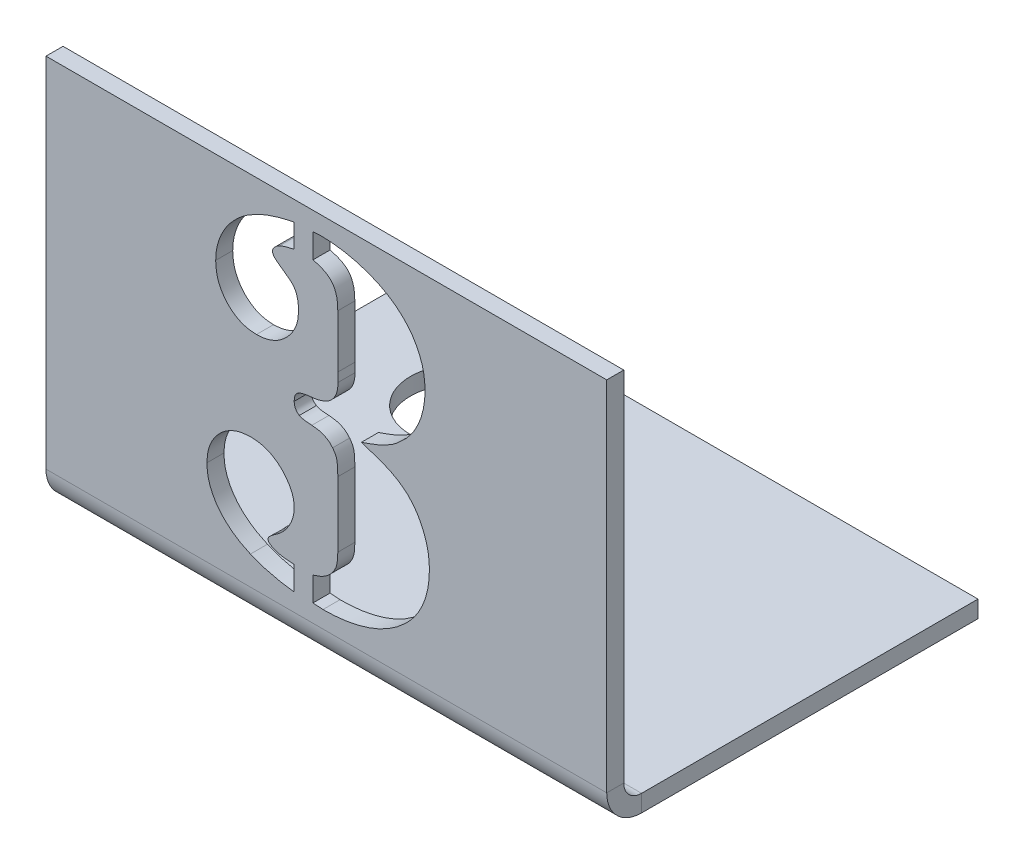
from build123d import *

# Parameters (mm, degrees)
SKETCH1_W            = 50
SKETCH1_H            = 30
BASE_FLANGE1_DEPTH   = 1.51892
EDGE_FLANGE1_DEPTH   = 50
M8_CLEARANCE_HOLE1_D = 9
CUT_EXTRUDE1_DEPTH   = 55.277389816


# Sheet-metal steps are written as plain solids
with BuildPart() as part:
    # Sketch1 → Base-Flange1 (new body)
    with BuildSketch(Plane(origin=(0, 0, 0), x_dir=(1, 0, 0), z_dir=(0, 1, 0))):
        with Locations((0, 15)):
            Rectangle(SKETCH1_W, SKETCH1_H)
    extrude(amount=BASE_FLANGE1_DEPTH)

    # Edge-Flange1 section (across the edge) → Edge-Flange1 (add)
    with BuildSketch(Plane(origin=(-25, 1.51892, 1.5875), x_dir=(0, 0, -1), z_dir=(1, 0, 0))):
        with BuildLine():
            Line((-1.51892, 1.5875), (-1.51892, 33.48108))
            Line((-1.51892, 33.48108), (0, 33.48108))
            Line((0, 33.48108), (0, 1.5875))
            ThreePointArc((0, 1.5875), (0.464967985, 0.464967985), (1.5875, 0))
            Line((1.5875, 0), (1.5875, -1.51892))
            ThreePointArc((1.5875, -1.51892), (-0.609070647, -0.609070647), (-1.51892, 1.5875))
        make_face()
    extrude(amount=EDGE_FLANGE1_DEPTH)

    # M8 Clearance Hole1 (through all)
    with Locations(Plane(origin=(0, 1.51892, 0), x_dir=(1, 0, 0), z_dir=(0, 1, 0))):
        with Locations((-13, 21.89358)):
            Hole(M8_CLEARANCE_HOLE1_D / 2)

    # Sketch11 → Cut-Extrude1 (cut, through all)
    with BuildSketch(Plane.XY.offset(3.10642)):
        with BuildLine():
            Line((-2.869538569, 33.243055556), (-2.869538569, 31.146701389))
            add(Edge.make_bspline(
                [(-2.869538569, 31.146701389), (-3.01357232, 31.115282068), (-3.280496425, 31.057055618), (-3.646840415, 30.962343881), (-3.9475465, 30.860313138), (-4.121760767, 30.781276405), (-4.200267736, 30.745659722)],
                knots=[0, 0, 0, 0, 1.269686499, 2.352989703, 3.257800252, 4, 4, 4, 4], degree=3))
            add(Edge.make_bspline(
                [(-4.200267736, 30.745659722), (-4.281834981, 30.700375981), (-4.44405021, 30.610318847), (-4.631868386, 30.42554641), (-4.778100714, 30.243615535), (-4.803405221, 30.109157533), (-4.813983013, 30.052951389)],
                knots=[0, 0, 0, 0, 1.160818746, 2.308555075, 3.292942072, 4, 4, 4, 4], degree=3))
            add(Edge.make_bspline(
                [(-4.813983013, 30.052951389), (-4.802283278, 29.997478267), (-4.777259629, 29.878831144), (-4.681807175, 29.704434105), (-4.520753141, 29.540755171), (-4.391964004, 29.43963963), (-4.321795513, 29.384548611)],
                knots=[0, 0, 0, 0, 0.7940992, 1.698436706, 2.746033816, 4, 4, 4, 4], degree=3))
            Line((-4.321795513, 29.384548611), (-3.252351069, 28.606770833))
            add(Edge.make_bspline(
                [(-3.252351069, 28.606770833), (-3.130862875, 28.499857988), (-2.882411926, 28.281214539), (-2.649527269, 27.806319007), (-2.50193834, 27.242757243), (-2.488090423, 26.829623379), (-2.48064968, 26.607638889)],
                knots=[0, 0, 0, 0, 0.867032692, 1.773136037, 2.803464674, 4, 4, 4, 4], degree=3))
            add(Edge.make_bspline(
                [(-2.48064968, 26.607638889), (-2.492637492, 26.361098821), (-2.516268305, 25.875110038), (-2.730466948, 25.175617912), (-3.088519053, 24.537190693), (-3.564773974, 23.967252331), (-4.134379829, 23.487656489), (-4.781738186, 23.14019304), (-5.486902729, 22.923424184), (-5.979090846, 22.900543117), (-6.229781625, 22.888888889)],
                knots=[0, 0, 0, 0, 1.007343294, 1.985711883, 2.961723928, 3.986119113, 5.010514297, 5.989830935, 6.976141781, 8, 8, 8, 8], degree=3))
            add(Edge.make_bspline(
                [(-6.229781625, 22.888888889), (-6.478327854, 22.903156783), (-6.964184536, 22.931047576), (-7.663353586, 23.144006328), (-8.292040001, 23.50556869), (-8.845310092, 23.993701438), (-9.298490935, 24.586871582), (-9.633360061, 25.260423943), (-9.832658042, 26.004994474), (-9.857014264, 26.52337312), (-9.869538569, 26.789930556)],
                knots=[0, 0, 0, 0, 1.001909129, 1.958525973, 2.917513965, 3.907788383, 4.91637554, 5.910554521, 6.925578375, 8, 8, 8, 8], degree=3))
            add(Edge.make_bspline(
                [(-9.869538569, 26.789930556), (-9.859889219, 27.025587755), (-9.840670068, 27.494959385), (-9.694589077, 28.187617489), (-9.462380398, 28.861547201), (-9.137798547, 29.51157095), (-8.732886437, 30.132437614), (-8.239142713, 30.701494978), (-7.688708992, 31.240857761), (-7.265229198, 31.541065603), (-7.050094125, 31.693576389)],
                knots=[0, 0, 0, 0, 0.960214927, 1.912513803, 2.873580615, 3.859654398, 4.867447084, 5.886778922, 6.926447075, 8, 8, 8, 8], degree=3))
            add(Edge.make_bspline(
                [(-7.050094125, 31.693576389), (-6.772080974, 31.862281532), (-6.189737815, 32.215661528), (-5.20167575, 32.633053003), (-4.084196932, 32.986281736), (-3.286550907, 33.15490085), (-2.869538569, 33.243055556)],
                knots=[0, 0, 0, 0, 0.86898849, 1.820235845, 2.860411111, 4, 4, 4, 4], degree=3))
        make_face()
        with BuildLine():
            add(Edge.make_bspline(
                [(3.127857264, 19.243055556), (3.399533056, 19.156779447), (3.9099092, 18.994699245), (4.619293445, 18.756064829), (5.218126213, 18.526205667), (5.860268683, 18.238928986), (6.55822811, 17.851769501), (7.028568149, 17.45241251), (7.259801709, 17.256076389)],
                knots=[0, 0, 0, 0, 1.109244647, 2.083851495, 2.912330965, 3.60379954, 4.821954509, 6, 6, 6, 6], degree=3))
            add(Edge.make_bspline(
                [(7.259801709, 17.256076389), (7.403085424, 17.109301178), (7.691101186, 16.814267132), (8.066056013, 16.30561361), (8.389598844, 15.740320931), (8.675141336, 15.129505705), (8.904554905, 14.48483349), (9.069496151, 13.817416154), (9.169628617, 13.137330205), (9.180554624, 12.678860674), (9.186016987, 12.449652778)],
                knots=[0, 0, 0, 0, 0.925681824, 1.860720568, 2.844614321, 3.863818686, 4.902667566, 5.930051873, 6.965147251, 8, 8, 8, 8], degree=3))
            add(Edge.make_bspline(
                [(9.186016987, 12.449652778), (9.181658716, 12.189958532), (9.173109529, 11.680542176), (9.062347215, 10.937072307), (8.904596862, 10.226030331), (8.660773743, 9.555195425), (8.365180383, 8.910174803), (7.992199613, 8.305678266), (7.558241504, 7.729843198), (7.219380124, 7.386391142), (7.047128098, 7.211805556)],
                knots=[0, 0, 0, 0, 1.069636491, 2.098199453, 3.092710985, 4.06725094, 5.034789928, 6.012900685, 6.989905889, 8, 8, 8, 8], degree=3))
            add(Edge.make_bspline(
                [(7.047128098, 7.211805556), (6.82076841, 7.007619098), (6.36470834, 6.596232726), (5.590429044, 6.078292356), (4.753201656, 5.621324343), (3.841494966, 5.257205024), (2.874230844, 4.963704604), (1.854844744, 4.758844409), (0.789438496, 4.636181022), (0.063659631, 4.619560458), (-0.305302458, 4.611111111)],
                knots=[0, 0, 0, 0, 0.914358564, 1.842211554, 2.789262651, 3.774150871, 4.784330977, 5.820899479, 6.892217011, 8, 8, 8, 8], degree=3))
            Line((-0.305302458, 4.611111111), (-1.192455236, 4.677951389))
            Line((-1.192455236, 4.677951389), (-1.192455236, 6.828993056))
            add(Edge.make_bspline(
                [(-1.192455236, 6.828993056), (-1.012335342, 6.884888557), (-0.670196011, 6.991062556), (-0.212405477, 7.217072889), (0.17137983, 7.478137224), (0.370520183, 7.692115991), (0.466398931, 7.795138889)],
                knots=[0, 0, 0, 0, 1.160234497, 2.203875682, 3.135232274, 4, 4, 4, 4], degree=3))
            add(Edge.make_bspline(
                [(0.466398931, 7.795138889), (0.559176182, 7.919267749), (0.740278408, 8.161568667), (0.920686343, 8.599633432), (1.006344359, 9.118338926), (1.014703405, 9.494186105), (1.01935032, 9.703125)],
                knots=[0, 0, 0, 0, 0.912418212, 1.781050509, 2.766453814, 4, 4, 4, 4], degree=3))
            Line((1.01935032, 9.703125), (1.01935032, 15.530381944))
            add(Edge.make_bspline(
                [(1.01935032, 15.530381944), (1.017394838, 15.664035552), (1.013779291, 15.911151497), (1.007803164, 16.252339027), (0.973985032, 16.533739407), (0.930986746, 16.835410712), (0.813838875, 17.180859331), (0.645473079, 17.409898938), (0.557544764, 17.529513889)],
                knots=[0, 0, 0, 0, 1.14638434, 2.119582521, 2.923191533, 3.574181997, 4.73312696, 6, 6, 6, 6], degree=3))
            add(Edge.make_bspline(
                [(0.557544764, 17.529513889), (0.451698553, 17.647488045), (0.235458824, 17.8885047), (-0.206751022, 18.134080192), (-0.724105338, 18.295106819), (-1.09794382, 18.326917788), (-1.295753847, 18.34375)],
                knots=[0, 0, 0, 0, 0.905434972, 1.849768747, 2.86224313, 4, 4, 4, 4], degree=3))
            add(Edge.make_bspline(
                [(-1.295753847, 18.34375), (-1.423505644, 18.352575986), (-1.657320976, 18.368729582), (-1.972470407, 18.408380295), (-2.219734611, 18.462774475), (-2.351672252, 18.524233198), (-2.407733013, 18.550347222)],
                knots=[0, 0, 0, 0, 1.349224309, 2.469392492, 3.349639561, 4, 4, 4, 4], degree=3))
            add(Edge.make_bspline(
                [(-2.407733013, 18.550347222), (-2.477979947, 18.59934055), (-2.616454801, 18.695919057), (-2.763510355, 18.903405953), (-2.853240567, 19.144951477), (-2.863946526, 19.317165512), (-2.869538569, 19.407118056)],
                knots=[0, 0, 0, 0, 1.002692209, 1.976565387, 2.943099551, 4, 4, 4, 4], degree=3))
            add(Edge.make_bspline(
                [(-2.869538569, 19.407118056), (-2.866820405, 19.494522373), (-2.861685312, 19.659644567), (-2.803631102, 19.888249453), (-2.696849273, 20.072170003), (-2.545198602, 20.218941416), (-2.329831682, 20.319939632), (-2.055295045, 20.401344932), (-1.709142225, 20.467776459), (-1.454030953, 20.493062962), (-1.313983013, 20.506944444)],
                knots=[0, 0, 0, 0, 0.964154815, 1.821458751, 2.573364043, 3.28527986, 4.115605652, 5.169745424, 6.446280636, 8, 8, 8, 8], degree=3))
            add(Edge.make_bspline(
                [(-1.313983013, 20.506944444), (-1.128271066, 20.52658406), (-0.777686475, 20.56365947), (-0.298389805, 20.718747176), (0.12125894, 20.903804853), (0.454525235, 21.176451739), (0.728650657, 21.496730604), (0.905981356, 21.889020852), (1.020875882, 22.333444599), (1.03180142, 22.64905756), (1.037579487, 22.815972222)],
                knots=[0, 0, 0, 0, 1.206487139, 2.277590685, 3.25210526, 4.158100247, 5.043711585, 5.959540244, 6.920885097, 8, 8, 8, 8], degree=3))
            Line((1.037579487, 22.815972222), (1.01935032, 23.611979167))
            Line((1.01935032, 23.611979167), (1.01935032, 28.345486111))
            add(Edge.make_bspline(
                [(1.01935032, 28.345486111), (1.014046137, 28.546304493), (1.004070673, 28.923979389), (0.917806639, 29.452283492), (0.759888407, 29.896342277), (0.541828936, 30.27123073), (0.232928607, 30.572438728), (-0.160382254, 30.822844642), (-0.644238487, 31.026539794), (-1.002637519, 31.120985808), (-1.192455236, 31.171006944)],
                knots=[0, 0, 0, 0, 1.207729273, 2.271350984, 3.204025308, 4.029379273, 4.856440094, 5.772250211, 6.820124109, 8, 8, 8, 8], degree=3))
            Line((-1.192455236, 31.171006944), (-1.192455236, 33.346354167))
            Line((-1.192455236, 33.346354167), (-0.62127468, 33.388888889))
            add(Edge.make_bspline(
                [(-0.62127468, 33.388888889), (-0.29895954, 33.381510181), (0.339221536, 33.366900404), (1.288168427, 33.261166978), (2.218114669, 33.084554211), (3.125193288, 32.841194019), (3.994902127, 32.546496337), (4.79925898, 32.17457951), (5.548297239, 31.768596333), (5.999095823, 31.441302135), (6.220739209, 31.280381944)],
                knots=[0, 0, 0, 0, 1.062345978, 2.103435471, 3.143153868, 4.179651654, 5.197400318, 6.165494324, 7.098031664, 8, 8, 8, 8], degree=3))
            add(Edge.make_bspline(
                [(6.220739209, 31.280381944), (6.421106073, 31.11449264), (6.815917107, 30.787617594), (7.335326398, 30.22814113), (7.782157247, 29.626087905), (8.146308036, 28.976899877), (8.438983205, 28.299536188), (8.648277803, 27.592036712), (8.771590832, 26.859085324), (8.788557197, 26.36099523), (8.797128098, 26.109375)],
                knots=[0, 0, 0, 0, 1.041872682, 2.052948383, 3.051690231, 4.040680903, 5.030071464, 6.003778541, 6.991568578, 8, 8, 8, 8], degree=3))
            add(Edge.make_bspline(
                [(8.797128098, 26.109375), (8.793857048, 25.884209775), (8.787437209, 25.442295279), (8.695400635, 24.794641145), (8.566006307, 24.173252341), (8.375534477, 23.579097563), (8.131413444, 23.014565424), (7.840375127, 22.473627675), (7.484383297, 21.968260344), (7.213878345, 21.65521155), (7.077510042, 21.497395833)],
                knots=[0, 0, 0, 0, 1.070771032, 2.101520072, 3.107445733, 4.0891512, 5.065112457, 6.031456212, 7.0076079, 8, 8, 8, 8], degree=3))
            add(Edge.make_bspline(
                [(7.077510042, 21.497395833), (6.827872455, 21.247690723), (6.343905625, 20.763592986), (5.630076842, 20.279513268), (5.001735613, 19.962862706), (4.454822947, 19.719789449), (3.820513873, 19.47902425), (3.367366084, 19.324649498), (3.127857264, 19.243055556)],
                knots=[0, 0, 0, 0, 1.378234323, 2.671952189, 3.348417604, 4.128354188, 5.010751703, 6, 6, 6, 6], degree=3))
        make_face()
        with BuildLine():
            Line((-2.869538569, 6.816840278), (-2.869538569, 4.677951389))
            add(Edge.make_bspline(
                [(-2.869538569, 4.677951389), (-3.237243727, 4.726610875), (-3.948636961, 4.820751598), (-4.963962403, 5.055787516), (-5.906941235, 5.308868112), (-6.489023398, 5.547094683), (-6.770580236, 5.662326389)],
                knots=[0, 0, 0, 0, 1.101981033, 2.131984921, 3.096429245, 4, 4, 4, 4], degree=3))
            add(Edge.make_bspline(
                [(-6.770580236, 5.662326389), (-7.064051644, 5.799000851), (-7.636401319, 6.065553509), (-8.40830946, 6.57361788), (-9.081381766, 7.142104615), (-9.643481064, 7.775588888), (-10.09168007, 8.46287086), (-10.410613079, 9.198165249), (-10.616622374, 9.971437016), (-10.637023383, 10.50391647), (-10.647316347, 10.772569444)],
                knots=[0, 0, 0, 0, 1.14011364, 2.223534059, 3.246727384, 4.238282223, 5.198961705, 6.126338867, 7.054677824, 8, 8, 8, 8], degree=3))
            add(Edge.make_bspline(
                [(-10.647316347, 10.772569444), (-10.633249162, 11.043291896), (-10.60594215, 11.568814322), (-10.394272571, 12.324090845), (-10.032354653, 13.0028978), (-9.546230073, 13.603643314), (-8.956306531, 14.102169236), (-8.278381263, 14.460793527), (-7.533659588, 14.682386767), (-7.013164906, 14.708719686), (-6.74627468, 14.722222222)],
                knots=[0, 0, 0, 0, 1.04874818, 2.035814479, 3.01242171, 4.012030177, 5.015548973, 5.985216227, 6.966894159, 8, 8, 8, 8], degree=3))
            add(Edge.make_bspline(
                [(-6.74627468, 14.722222222), (-6.598287469, 14.716433656), (-6.305164596, 14.704968063), (-5.873847784, 14.647738438), (-5.463531534, 14.534320837), (-5.07094906, 14.386005233), (-4.706038982, 14.177326592), (-4.349370944, 13.944638461), (-4.020350943, 13.65459121), (-3.821493562, 13.43597484), (-3.720233013, 13.324652778)],
                knots=[0, 0, 0, 0, 1.031290511, 2.042709187, 3.021331464, 3.99055548, 4.956489103, 5.94240405, 6.952247613, 8, 8, 8, 8], degree=3))
            add(Edge.make_bspline(
                [(-3.720233013, 13.324652778), (-3.590550959, 13.160589992), (-3.338125476, 12.841242583), (-3.070845433, 12.306880162), (-2.901510354, 11.752982507), (-2.880223064, 11.375319918), (-2.869538569, 11.185763889)],
                knots=[0, 0, 0, 0, 1.065605338, 2.074195566, 3.033402167, 4, 4, 4, 4], degree=3))
            add(Edge.make_bspline(
                [(-2.869538569, 11.185763889), (-2.876387923, 11.049753415), (-2.889994975, 10.779552492), (-2.969993099, 10.372684565), (-3.119377334, 9.977290257), (-3.312563785, 9.586706214), (-3.556014541, 9.219681769), (-3.834935455, 8.875564288), (-4.157896697, 8.571693603), (-4.396825986, 8.398294647), (-4.516239958, 8.311631944)],
                knots=[0, 0, 0, 0, 0.949066747, 1.885433545, 2.877469731, 3.888236511, 4.918652548, 5.942365831, 6.971619307, 8, 8, 8, 8], degree=3))
            add(Edge.make_bspline(
                [(-4.516239958, 8.311631944), (-4.616956011, 8.242350669), (-4.797132432, 8.11840963), (-5.015945254, 7.934748987), (-5.16339751, 7.772785147), (-5.191533881, 7.658785349), (-5.202871902, 7.612847222)],
                knots=[0, 0, 0, 0, 1.459644985, 2.611238258, 3.44037521, 4, 4, 4, 4], degree=3))
            add(Edge.make_bspline(
                [(-5.202871902, 7.612847222), (-5.193283576, 7.55994481), (-5.171670785, 7.440698884), (-5.014074165, 7.294918338), (-4.789583665, 7.164993449), (-4.366343077, 6.990962823), (-3.714539583, 6.849122385), (-3.162030754, 6.828014541), (-2.869538569, 6.816840278)],
                knots=[0, 0, 0, 0, 0.364280976, 0.821116089, 1.413109052, 2.174055433, 3.974586417, 6, 6, 6, 6], degree=3))
        make_face()
    extrude(amount=-CUT_EXTRUDE1_DEPTH, mode=Mode.SUBTRACT)


solid = part.part
